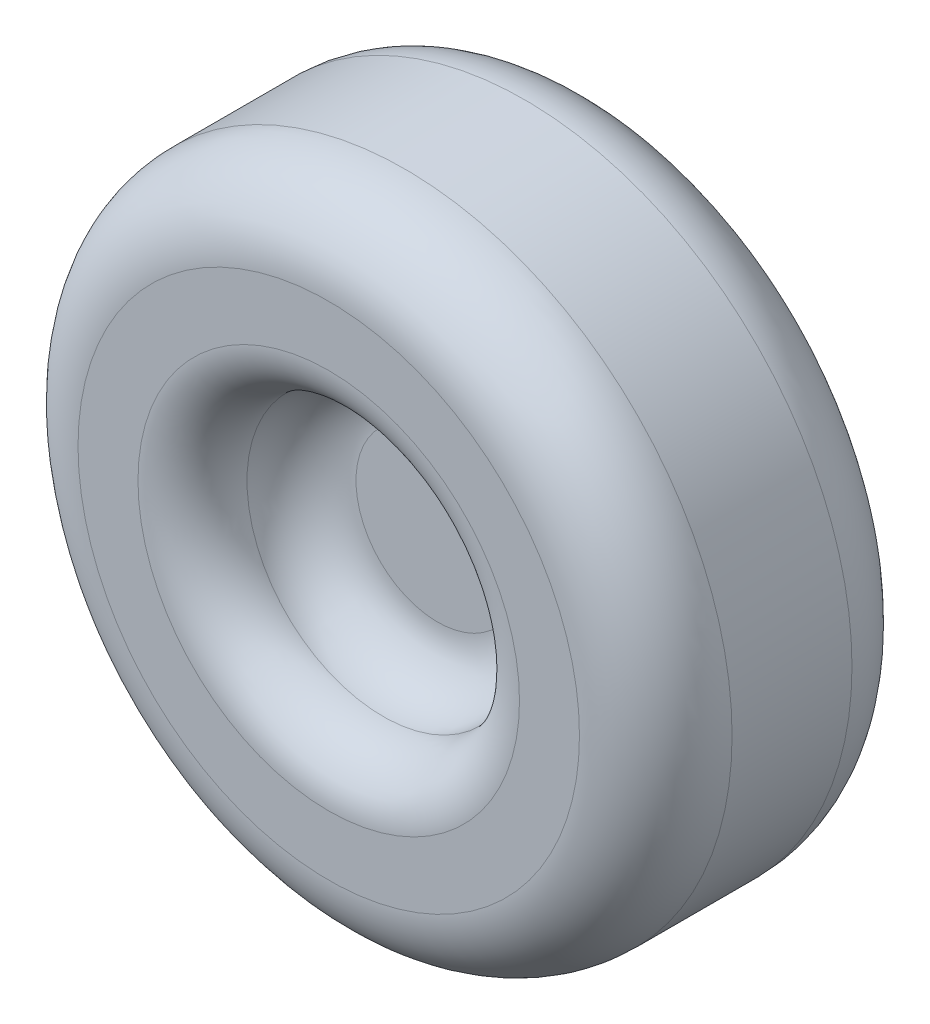
from build123d import *

# Parameters (mm, degrees)
SKETCH1_R           = 30
BOSS_EXTRUDE1_DEPTH = 25
SKETCH2_R           = 12.5
CUT_EXTRUDE1_DEPTH  = 10
FILLET1_R           = 5
FILLET2_R           = 7


with BuildPart() as part:
    # Sketch1 → Boss-Extrude1 (new body)
    with BuildSketch(Plane.XY):
        Circle(SKETCH1_R)
    extrude(amount=BOSS_EXTRUDE1_DEPTH)

    # Sketch2 → Cut-Extrude1 (cut)
    with BuildSketch(Plane.XY.offset(25)):
        Circle(SKETCH2_R)
    extrude(amount=-CUT_EXTRUDE1_DEPTH, mode=Mode.SUBTRACT)

    # Fillet1
    fillet1_edges = [part.edges().sort_by_distance(p)[0] for p in [
        (-12.5, 0, 15),
        (-12.5, 0, 25),
    ]]
    fillet(fillet1_edges, radius=FILLET1_R - 0.0001)  # a hair under: the kernel refuses the full size

    # Fillet2
    fillet2_edges = [part.edges().sort_by_distance(p)[0] for p in [
        (-30, 0, 0),
        (-30, 0, 25),
    ]]
    fillet(fillet2_edges, radius=FILLET2_R)


solid = part.part
